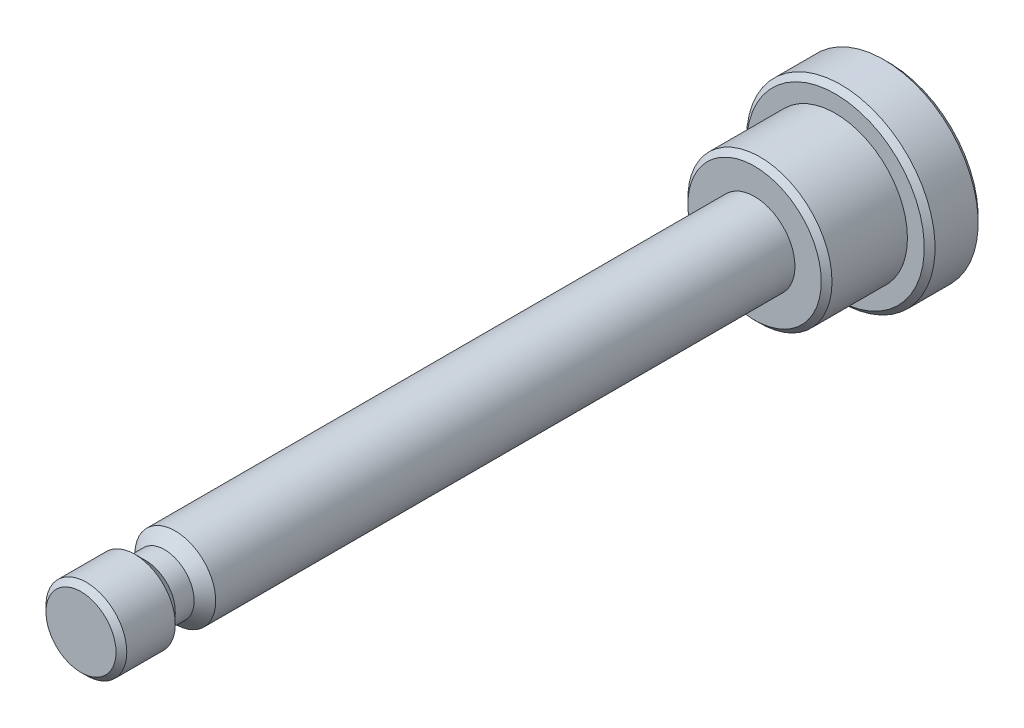
from build123d import *

# Parameters (mm, degrees)
SKETCH1_R         = 2.675
COUNTERSINK_DEPTH = 3
SKETCH2_R         = 1.5
SHAFT_DEPTH       = 25
SKETCH3_R         = 3.5
HEAD_DEPTH        = 2
DEBURS_SIZE       = 0.2


with BuildPart() as part:
    # Sketch1 → Countersink (new body)
    with BuildSketch(Plane.XY):
        Circle(SKETCH1_R)
    extrude(amount=-COUNTERSINK_DEPTH)

    # Sketch2 → Shaft (add)
    with BuildSketch(Plane.XY):
        Circle(SKETCH2_R)
    extrude(amount=SHAFT_DEPTH)

    # Sketch3 → Head (add)
    with BuildSketch(Plane(origin=(0, 0, -3), x_dir=(-1, 0, 0), z_dir=(0, 0, -1))):
        Circle(SKETCH3_R)
    extrude(amount=HEAD_DEPTH)

    # Sketch4 → e-Clip Notch (revolve, cut)
    with BuildSketch(Plane(origin=(0, 0, 0), x_dir=(0, 0, -1), z_dir=(1, 0, 0))):
        Polygon((-23, 1.5), (-21.5, 1.5), (-21.9, 1.1), (-22.6, 1.1), align=None)
    revolve(axis=Axis((0, 0, 0), (0, 0, 1)), mode=Mode.SUBTRACT)

    # Deburs
    deburs_edges = [part.edges().sort_by_distance(p)[0] for p in [
        (-1.5, 0, 25),
        (3.5, 0, -3),
        (3.5, 0, -5),
        (-2.675, 0, 0),
    ]]
    chamfer(deburs_edges, length=DEBURS_SIZE)


solid = part.part
